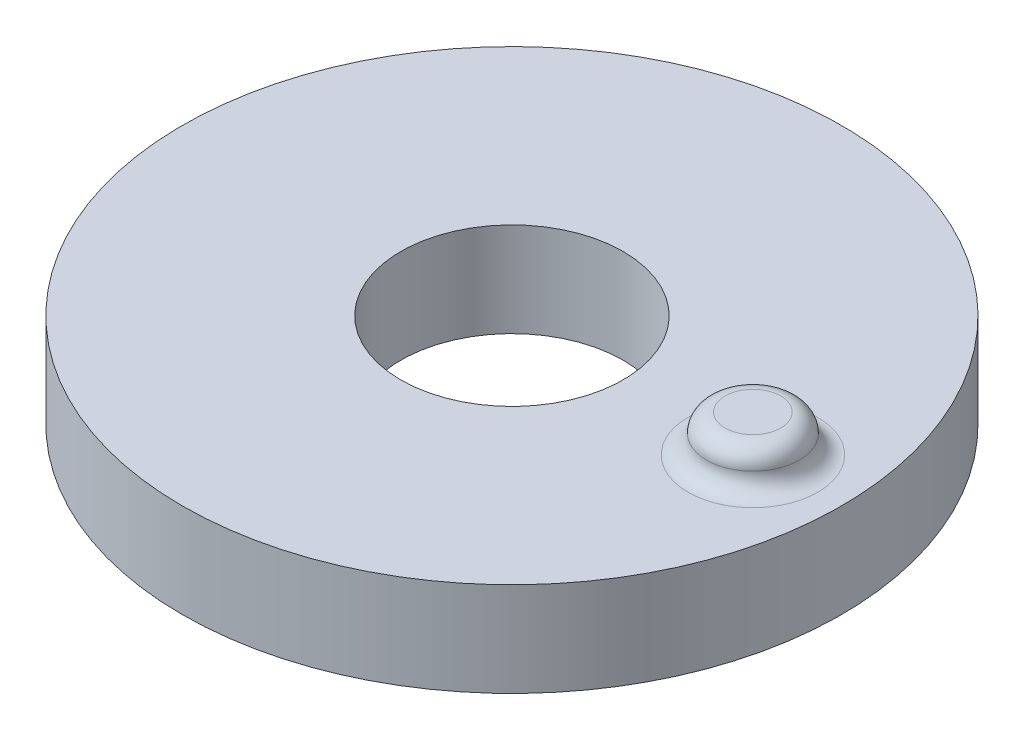
from build123d import *

# Parameters (mm, degrees)
SKETCH1_R           = 88.9
BOSS_EXTRUDE1_DEPTH = 25.4
SKETCH2_R           = 12.5
BOSS_EXTRUDE2_DEPTH = 10
FILLET1_R           = 5
SKETCH3_R           = 30
CUT_EXTRUDE1_DEPTH  = 129.263712717


with BuildPart() as part:
    # Sketch1 → Boss-Extrude1 (new body)
    with BuildSketch(Plane(origin=(0, 0, 0), x_dir=(1, 0, 0), z_dir=(0, 1, 0))):
        with Locations(Location((0, 0, 0), (0, 0, 270))):
            Circle(SKETCH1_R)
    extrude(amount=BOSS_EXTRUDE1_DEPTH)

    # Sketch2 → Boss-Extrude2 (add)
    with BuildSketch(Plane(origin=(0, 25.4, 0), x_dir=(1, 0, 0), z_dir=(0, 1, 0))):
        with Locations(Location((65, 0, 0), (0, 0, 270))):
            Circle(SKETCH2_R)
    extrude(amount=BOSS_EXTRUDE2_DEPTH)

    # Fillet1
    fillet1_edges = [part.edges().sort_by_distance(p)[0] for p in [
        (65, 25.4, -12.5),
        (65, 35.4, -12.5),
    ]]
    fillet(fillet1_edges, radius=FILLET1_R - 0.0001)  # a hair under: the kernel refuses the full size

    # Sketch3 → Cut-Extrude1 (cut, through all)
    with BuildSketch(Plane(origin=(0, 25.4, 0), x_dir=(1, 0, 0), z_dir=(0, 1, 0))):
        with Locations(Location((0, 0, 0), (0, 0, 270))):
            Circle(SKETCH3_R)
    extrude(amount=-CUT_EXTRUDE1_DEPTH, mode=Mode.SUBTRACT)


solid = part.part
